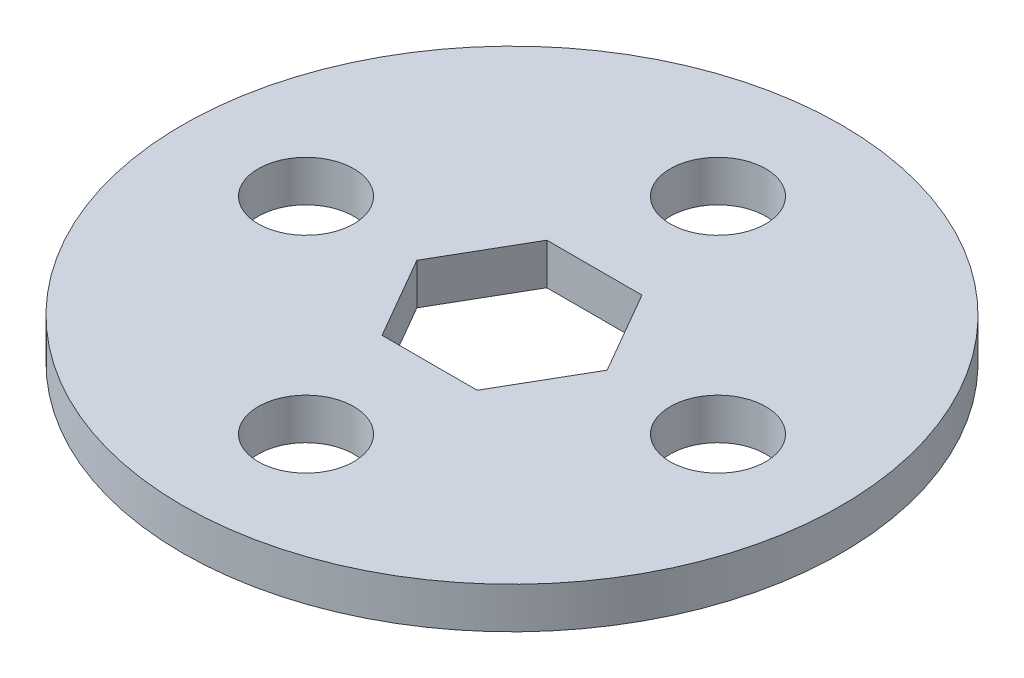
from build123d import *

# Parameters (mm, degrees)
SKETCH1_R           = 25.4
SKETCH1_R_2         = 3.683
BOSS_EXTRUDE1_DEPTH = 3.175


with BuildPart() as part:
    # Sketch1 → Boss-Extrude1 (new body)
    with BuildSketch(Plane(origin=(0, 0, 0), x_dir=(1, 0, 0), z_dir=(0, 1, 0))):
        Circle(SKETCH1_R)
        with Locations((0, 15.875)):
            Circle(SKETCH1_R_2, mode=Mode.SUBTRACT)
        with Locations((15.875, 0)):
            Circle(SKETCH1_R_2, mode=Mode.SUBTRACT)
        with Locations((0, -15.875)):
            Circle(SKETCH1_R_2, mode=Mode.SUBTRACT)
        with Locations((-15.875, 0)):
            Circle(SKETCH1_R_2, mode=Mode.SUBTRACT)
        Polygon((-7.332348419, 0), (-3.666174209, -6.35), (3.666174209, -6.35), (7.332348419, 0), (3.666174209, 6.35), (-3.666174209, 6.35), align=None, mode=Mode.SUBTRACT)
    extrude(amount=BOSS_EXTRUDE1_DEPTH)


solid = part.part
